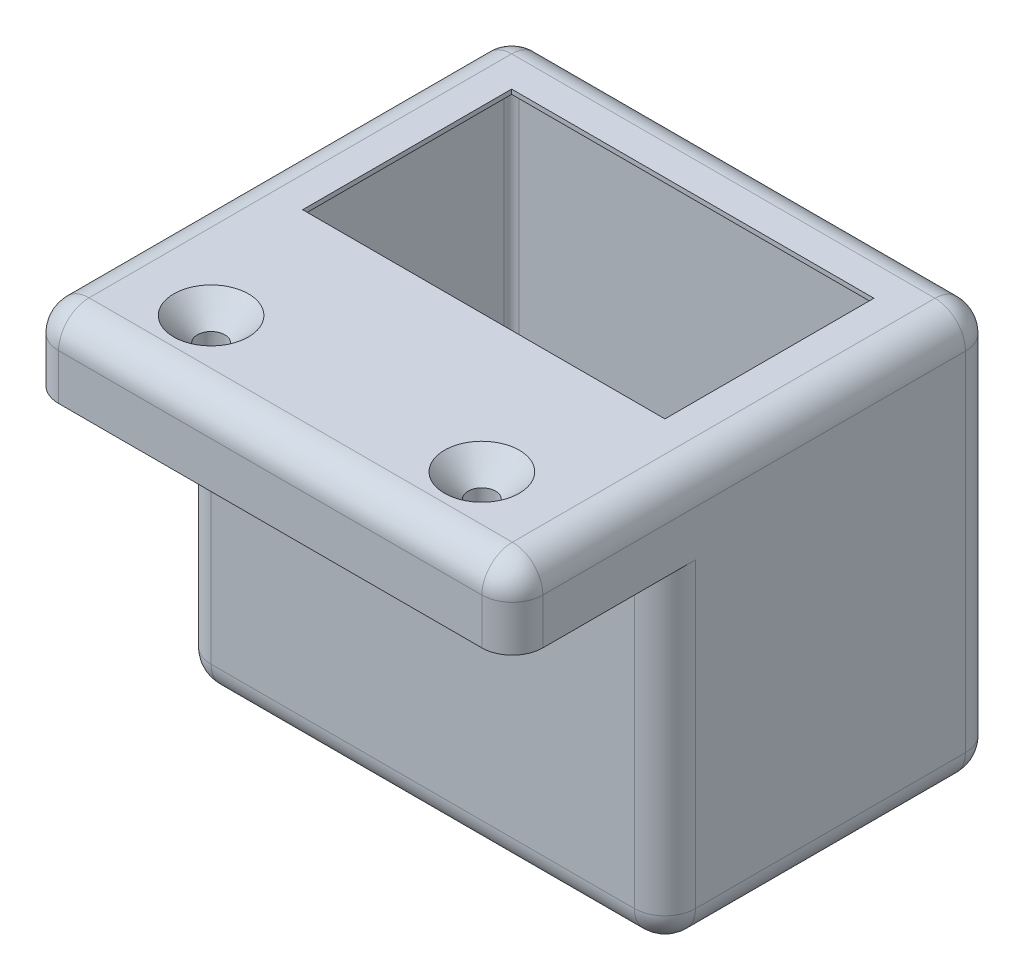
from build123d import *

# Parameters (mm, degrees)
PROFILE_EXTRUDE_DEPTH                           = 31.75
INTERIOR_START                                  = -3
INTERIOR_SKETCH_W                               = 57.5
INTERIOR_SKETCH_H                               = 37.4
INTERIOR_CUT_DEPTH                              = 50
OPENING_CUT_REACH                               = 77.925
OPENING_SKETCH_W                                = 47.5
OPENING_SKETCH_H                                = 27.4
CHAMFER1_SIZE                                   = 5
FILLET1_R                                       = 1
CUT_EXTRUDE3_REACH                              = 77.925
SKETCH5_R                                       = 9.5
FILLET2_R                                       = 1.5
FILLET3_R                                       = 4
CSK_FOR_M3_FLAT_HEAD_MACHINE_SCREW1_D           = 3.6
CSK_FOR_M3_FLAT_HEAD_MACHINE_SCREW1_CSINK_D     = 9.8
CSK_FOR_M3_FLAT_HEAD_MACHINE_SCREW1_CSINK_ANGLE = 90


with BuildPart() as part:
    # Profile Sketch → Profile Extrude (new, symmetric)
    with BuildSketch(Plane(origin=(0, 0, 0), x_dir=(0, 0, -1), z_dir=(1, 0, 0))):
        Polygon((0, 0), (0, 43.6), (-20, 43.6), (-20, 53.6), (43.4, 53.6), (43.4, 0), align=None)
    extrude(amount=PROFILE_EXTRUDE_DEPTH, both=True)

    # Interior Sketch → Interior Cut (cut)
    with BuildSketch(Plane.XZ.offset(INTERIOR_START)):
        with Locations((0, -21.7)):
            Rectangle(INTERIOR_SKETCH_W, INTERIOR_SKETCH_H)
    extrude(amount=-INTERIOR_CUT_DEPTH, mode=Mode.SUBTRACT)

    # Opening Sketch → Opening Cut (cut, up to next)
    with BuildSketch(Plane(origin=(0, 53.6, 0), x_dir=(1, 0, 0), z_dir=(0, 1, 0)), mode=Mode.PRIVATE) as opening_cut_sk1:
        with Locations((0, 21.7)):
            Rectangle(OPENING_SKETCH_W, OPENING_SKETCH_H)
    opening_cut_tool1 = extrude(opening_cut_sk1.sketch, amount=-OPENING_CUT_REACH, mode=Mode.PRIVATE) & part.part
    add(opening_cut_tool1.solids().sort_by_distance((0, 53.6, -21.7))[0], mode=Mode.SUBTRACT)

    # Chamfer1
    chamfer1_edges = [part.edges().sort_by_distance(p)[0] for p in [
        (0, 53, -3),
        (28.75, 53, -21.7),
        (0, 53, -40.4),
        (-28.75, 53, -21.7),
    ]]
    chamfer(chamfer1_edges, length=CHAMFER1_SIZE - 0.0001)  # a hair under: the kernel refuses the full size

    # Fillet1
    fillet1_edges = [part.edges().sort_by_distance(p)[0] for p in [
        (28.75, 25.50005, -40.4),
        (28.75, 25.50005, -3),
        (-28.75, 25.50005, -40.4),
        (-28.75, 25.50005, -3),
    ]]
    fillet(fillet1_edges, radius=FILLET1_R)

    # Sketch5 → Cut-Extrude3 (cut, up to next)
    with BuildSketch(Plane.XZ, mode=Mode.PRIVATE) as cut_extrude3_sk1:
        with Locations(Location((0, -21.7, 0), (0, 0, 270))):
            Circle(SKETCH5_R)
    cut_extrude3_tool1 = extrude(cut_extrude3_sk1.sketch, amount=-CUT_EXTRUDE3_REACH, mode=Mode.PRIVATE) & part.part
    add(cut_extrude3_tool1.solids().sort_by_distance((0, 0, -21.7))[0], mode=Mode.SUBTRACT)

    # Fillet2
    fillet2_edges = [part.edges().sort_by_distance(p)[0] for p in [
        (0, 0, -12.2),
        (0, 3, -12.2),
    ]]
    fillet(fillet2_edges, radius=FILLET2_R - 0.0001)  # a hair under: the kernel refuses the full size

    # Fillet3
    fillet3_edges = [part.edges().sort_by_distance(p)[0] for p in [
        (0, 0, 0),
        (0, 53.6, 20),
        (0, 53.6, -43.4),
        (0, 0, -43.4),
        (31.75, 53.6, -11.7),
        (31.75, 48.6, 20),
        (31.75, 21.8, 0),
        (31.75, 0, -21.7),
        (-31.75, 21.8, 0),
        (-31.75, 48.6, 20),
        (-31.75, 53.6, -11.7),
        (-31.75, 26.8, -43.4),
        (-31.75, 0, -21.7),
        (31.75, 26.8, -43.4),
    ]]
    fillet(fillet3_edges, radius=FILLET3_R)

    # CSK for M3 Flat Head Machine Screw1 (through all)
    with Locations(Plane(origin=(-17.75, 53.6, 10), x_dir=(0, 0, 1), z_dir=(0, 1, 0))):
        with Locations((0, 0), (0, 35.5)):
            CounterSinkHole(CSK_FOR_M3_FLAT_HEAD_MACHINE_SCREW1_D / 2, CSK_FOR_M3_FLAT_HEAD_MACHINE_SCREW1_CSINK_D / 2, counter_sink_angle=CSK_FOR_M3_FLAT_HEAD_MACHINE_SCREW1_CSINK_ANGLE)


solid = part.part
